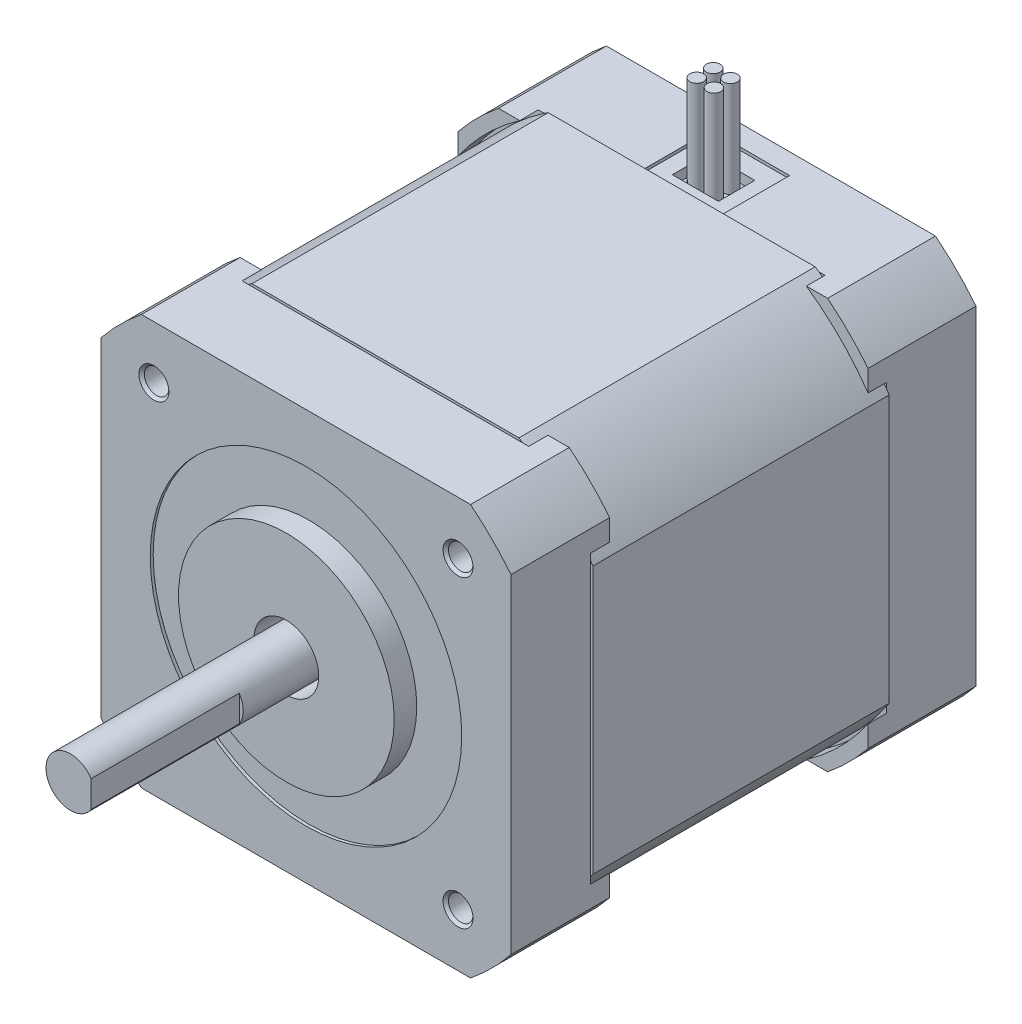
from build123d import *

# Parameters (mm, degrees)
EXTRUDE_1_DEPTH                      = 11
SKETCH_2_R                           = 25.5
CUT_EXTRUDE_1_DEPTH                  = 1.9
EXTRUDE_2_DEPTH                      = 30.2
EXTRUDE_START                        = 39.3
EXTRUDE_3_DEPTH                      = 8.1
EXTRUDE_START_2                      = 1.96
EXTRUDE_4_DEPTH                      = 1.96
SKETCH_5_R                           = 15.875
CUT_EXTRUDE_2_DEPTH                  = 0.3
SKETCH_6_R                           = 10.995
EXTRUDE_5_DEPTH                      = 2.3
SKETCH_7_R                           = 3.3
CUT_EXTRUDE_3_DEPTH                  = 5
SKETCH_8_R                           = 2.5
EXTRUDE_7_DEPTH                      = 27
SKETCH_9_W                           = 0.4
SKETCH_9_H                           = 2.712931994
CUT_EXTRUDE_4_DEPTH                  = 15.1
SKETCH_12_R                          = 3
CUT_EXTRUDE_5_DEPTH                  = 0.3
SKETCH_13_W                          = 1.542437781
SKETCH_13_H                          = 0.838241738
SKETCH_13_W_2                        = 0.838241738
SKETCH_13_H_2                        = 1.542437781
CUT_EXTRUDE_6_DEPTH                  = 2
CHAMFER_1_SIZE                       = 1.54
FILLET_1_R                           = 0.5
PATTERN_CIRCULAR_1_COUNT             = 4
CHAMFER_1_OF_PATTERN_CIRCULAR_1_SIZE = 1.54
FILLET_1_OF_PATTERN_CIRCULAR_1_R     = 0.5
SKETCH_14_W                          = 8
SKETCH_14_H                          = 7
CUT_EXTRUDE_7_DEPTH                  = 0.3
SKETCH_15_W                          = 4.7
SKETCH_15_H                          = 3.7
CUT_EXTRUDE_8_DEPTH                  = 1
SKETCH_16_R                          = 0.7
EXTRUDE_8_DEPTH                      = 9.8


with BuildPart() as part:
    # Эскиз1 → Бобышка-Вытянуть1 (new body)
    with BuildSketch(Plane.XY):
        with BuildLine():
            ThreePointArc((20.9, 16.775875536), (18.950461736, 18.950461736), (16.775875536, 20.9))
            Line((16.775875536, 20.9), (-16.775875536, 20.9))
            ThreePointArc((-16.775875536, 20.9), (-18.950461736, 18.950461736), (-20.9, 16.775875536))
            Line((-20.9, 16.775875536), (-20.9, -16.775875536))
            ThreePointArc((-20.9, -16.775875536), (-18.950461736, -18.950461736), (-16.775875536, -20.9))
            Line((-16.775875536, -20.9), (16.775875536, -20.9))
            ThreePointArc((16.775875536, -20.9), (18.950461736, -18.950461736), (20.9, -16.775875536))
            Line((20.9, -16.775875536), (20.9, 16.775875536))
        make_face()
    extrude(amount=EXTRUDE_1_DEPTH)

    # Эскиз2 → Вырез-Вытянуть1 (cut)
    with BuildSketch(Plane.XY.offset(11)):
        Circle(SKETCH_2_R)
    extrude(amount=-CUT_EXTRUDE_1_DEPTH, mode=Mode.SUBTRACT)

    # Эскиз3 → Бобышка-Вытянуть2 (add)
    with BuildSketch(Plane.XY.offset(9.1)):
        with BuildLine():
            ThreePointArc((20.9, 13.989728375), (17.783735547, 17.783735547), (13.989728375, 20.9))
            Line((13.989728375, 20.9), (-13.989728375, 20.9))
            ThreePointArc((-13.989728375, 20.9), (-17.783735547, 17.783735547), (-20.9, 13.989728375))
            Line((-20.9, 13.989728375), (-20.9, -13.989728375))
            ThreePointArc((-20.9, -13.989728375), (-17.783735547, -17.783735547), (-13.989728375, -20.9))
            Line((-13.989728375, -20.9), (13.989728375, -20.9))
            ThreePointArc((13.989728375, -20.9), (17.783735547, -17.783735547), (20.9, -13.989728375))
            Line((20.9, -13.989728375), (20.9, 13.989728375))
        make_face()
        with BuildLine():
            ThreePointArc((13.989728375, 20.9), (13.799840663, 21.02586259), (13.608820669, 21.15))
            Line((13.608820669, 21.15), (-13.608820669, 21.15))
            ThreePointArc((-13.608820669, 21.15), (-13.799840663, 21.02586259), (-13.989728375, 20.9))
            Line((-13.989728375, 20.9), (13.989728375, 20.9))
        make_face()
        with BuildLine():
            Line((21.15, -13.608820669), (21.15, 13.608820669))
            ThreePointArc((21.15, 13.608820669), (21.02586259, 13.799840663), (20.9, 13.989728375))
            Line((20.9, 13.989728375), (20.9, -13.989728375))
            ThreePointArc((20.9, -13.989728375), (21.02586259, -13.799840663), (21.15, -13.608820669))
        make_face()
        with BuildLine():
            Line((-13.608820669, -21.15), (13.608820669, -21.15))
            ThreePointArc((13.608820669, -21.15), (13.799840663, -21.02586259), (13.989728375, -20.9))
            Line((13.989728375, -20.9), (-13.989728375, -20.9))
            ThreePointArc((-13.989728375, -20.9), (-13.799840663, -21.02586259), (-13.608820669, -21.15))
        make_face()
        with BuildLine():
            ThreePointArc((-20.9, 13.989728375), (-21.02586259, 13.799840663), (-21.15, 13.608820669))
            Line((-21.15, 13.608820669), (-21.15, -13.608820669))
            ThreePointArc((-21.15, -13.608820669), (-21.02586259, -13.799840663), (-20.9, -13.989728375))
            Line((-20.9, -13.989728375), (-20.9, 13.989728375))
        make_face()
    extrude(amount=EXTRUDE_2_DEPTH)

    # Эскиз1<3> → Бобышка-Вытянуть3 (add)
    with BuildSketch(Plane.XY.offset(EXTRUDE_START)):
        with BuildLine():
            ThreePointArc((20.9, 16.775875536), (18.950461736, 18.950461736), (16.775875536, 20.9))
            Line((16.775875536, 20.9), (-16.775875536, 20.9))
            ThreePointArc((-16.775875536, 20.9), (-18.950461736, 18.950461736), (-20.9, 16.775875536))
            Line((-20.9, 16.775875536), (-20.9, -16.775875536))
            ThreePointArc((-20.9, -16.775875536), (-18.950461736, -18.950461736), (-16.775875536, -20.9))
            Line((-16.775875536, -20.9), (16.775875536, -20.9))
            ThreePointArc((16.775875536, -20.9), (18.950461736, -18.950461736), (20.9, -16.775875536))
            Line((20.9, -16.775875536), (20.9, 16.775875536))
        make_face()
    extrude(amount=EXTRUDE_3_DEPTH)

    # Эскиз4 → Бобышка-Вытянуть4 (add)
    with BuildSketch(Plane(origin=(0, 0, 39.3), x_dir=(-1, 0, 0), z_dir=(0, 0, -1)).offset(EXTRUDE_START_2)):
        with BuildLine():
            Line((14.609585894, 20.9), (16.775875536, 20.9))
            ThreePointArc((16.775875536, 20.9), (18.950461736, 18.950461736), (20.9, 16.775875536))
            Line((20.9, 16.775875536), (20.9, 14.609585894))
            ThreePointArc((20.9, 14.609585894), (18.03122292, 18.03122292), (14.609585894, 20.9))
        make_face()
        with BuildLine():
            Line((20.9, -14.609585894), (20.9, -16.775875536))
            ThreePointArc((20.9, -16.775875536), (18.950461736, -18.950461736), (16.775875536, -20.9))
            Line((16.775875536, -20.9), (14.609585894, -20.9))
            ThreePointArc((14.609585894, -20.9), (18.03122292, -18.03122292), (20.9, -14.609585894))
        make_face()
        with BuildLine():
            Line((-14.609585894, -20.9), (-16.775875536, -20.9))
            ThreePointArc((-16.775875536, -20.9), (-18.950461736, -18.950461736), (-20.9, -16.775875536))
            Line((-20.9, -16.775875536), (-20.9, -14.609585894))
            ThreePointArc((-20.9, -14.609585894), (-18.03122292, -18.03122292), (-14.609585894, -20.9))
        make_face()
        with BuildLine():
            Line((-20.9, 14.609585894), (-20.9, 16.775875536))
            ThreePointArc((-20.9, 16.775875536), (-18.950461736, 18.950461736), (-16.775875536, 20.9))
            Line((-16.775875536, 20.9), (-14.609585894, 20.9))
            ThreePointArc((-14.609585894, 20.9), (-18.03122292, 18.03122292), (-20.9, 14.609585894))
        make_face()
    extrude(amount=-EXTRUDE_4_DEPTH)

    # Эскиз5 → Вырез-Вытянуть2 (cut)
    with BuildSketch(Plane.XY.offset(47.4)):
        Circle(SKETCH_5_R)
    extrude(amount=-CUT_EXTRUDE_2_DEPTH, mode=Mode.SUBTRACT)

    # Эскиз6 → Бобышка-Вытянуть5 (add)
    with BuildSketch(Plane.XY.offset(47.1)):
        Circle(SKETCH_6_R)
    extrude(amount=EXTRUDE_5_DEPTH)

    # Эскиз7 → Вырез-Вытянуть3 (cut)
    with BuildSketch(Plane.XY.offset(49.4)):
        Circle(SKETCH_7_R)
    extrude(amount=-CUT_EXTRUDE_3_DEPTH, mode=Mode.SUBTRACT)

    # Эскиз8 → Бобышка-Вытянуть7 (add)
    with BuildSketch(Plane.XY.offset(44.4)):
        with Locations(Location((0, 0, 0), (0, 0, 180))):
            Circle(SKETCH_8_R)
    extrude(amount=EXTRUDE_7_DEPTH)

    # Эскиз9 → Вырез-Вытянуть4 (cut)
    with BuildSketch(Plane.XY.offset(71.4)):
        with Locations((2.3, 0)):
            Rectangle(SKETCH_9_W, SKETCH_9_H)
    extrude(amount=-CUT_EXTRUDE_4_DEPTH, mode=Mode.SUBTRACT)

    # Эскиз11 → Отверстие обработанное метчиком M31 (revolve, cut)
    with BuildSketch(Plane(origin=(-15.5, 15.5, 47.4), x_dir=(0, -1, 0), z_dir=(1, 0, 0))):
        Polygon((0, 0), (0, 6.751075774), (1.25, 6), (1.25, 0.275), (1.525, 0), align=None)
    hole_wizard_m31 = revolve(axis=Axis((-15.5, 15.5, 53.75), (0, 0, -1)), mode=Mode.SUBTRACT)

    # Эскиз12 → Вырез-Вытянуть5 (cut)
    with BuildSketch(Plane(origin=(0, 0, 0), x_dir=(-1, 0, 0), z_dir=(0, 0, -1))):
        with Locations((15.5, 15.5)):
            Circle(SKETCH_12_R)
    cut_extrude_5 = extrude(amount=-CUT_EXTRUDE_5_DEPTH, mode=Mode.SUBTRACT)

    # Эскиз13 → Вырез-Вытянуть6 (cut)
    with BuildSketch(Plane(origin=(0, 0, 0.3), x_dir=(-1, 0, 0), z_dir=(0, 0, -1))):
        with Locations((14.309660241, 15.5)):
            Rectangle(SKETCH_13_W, SKETCH_13_H)
        with Locations((15.5, 16.690339759)):
            Rectangle(SKETCH_13_W_2, SKETCH_13_H_2)
        with Locations((15.5, 15.5)):
            Rectangle(SKETCH_13_W_2, SKETCH_13_H)
        with Locations((16.690339759, 15.5)):
            Rectangle(SKETCH_13_W, SKETCH_13_H)
        with Locations((15.5, 14.309660241)):
            Rectangle(SKETCH_13_W_2, SKETCH_13_H_2)
    cut_extrude_6 = extrude(amount=-CUT_EXTRUDE_6_DEPTH, mode=Mode.SUBTRACT)

    # Фаска1
    chamfer_1_edges = [part.edges().sort_by_distance(p)[0] for p in [
        (-13.53844135, 15.5, 2.3),
        (-15.5, 13.53844135, 2.3),
        (-15.5, 17.46155865, 2.3),
        (-17.46155865, 15.5, 2.3),
    ]]
    chamfer(chamfer_1_edges, length=CHAMFER_1_SIZE)

    # Скругление1
    # the kernel refuses this fillet: 0.5 mm, written as the material it takes off along each edge
    with BuildSketch(Plane(origin=(-15.080879131, 15.080879131, -0.95), x_dir=(0, -1, 0), z_dir=(0, 0, 1))) as fillet_1_piece_1_section:
        with BuildLine():
            CenterArc((FILLET_1_R, FILLET_1_R), FILLET_1_R, 180, 90)
            Line((0, FILLET_1_R), (0, 0))
            Line((0, 0), (FILLET_1_R, 0))
        make_face()
    fillet_1_piece_1 = extrude(amount=3.25, mode=Mode.PRIVATE)
    fillet_1_piece_1 = split(fillet_1_piece_1, bisect_by=Plane(origin=(-14.969196905, 14.165454231, 1.38701288), z_dir=(0, 0.7071067811865478, -0.7071067811865474)), keep=Keep.TOP, mode=Mode.PRIVATE)
    fillet_1_piece_1 = split(fillet_1_piece_1, bisect_by=Plane(origin=(-14.165454231, 14.969196905, 1.38701288), z_dir=(-0.7071067811865478, 1.491325558184438e-15, -0.7071067811865474)), keep=Keep.TOP, mode=Mode.PRIVATE)
    add(fillet_1_piece_1, mode=Mode.SUBTRACT)
    with BuildSketch(Plane(origin=(-15.919120869, 15.080879131, -0.95), x_dir=(0, -1, 0), z_dir=(0, 0, 1))) as fillet_1_piece_2_section:
        with BuildLine():
            CenterArc((FILLET_1_R, -FILLET_1_R), FILLET_1_R, 90, 90)
            Line((0, -FILLET_1_R), (0, 0))
            Line((0, 0), (FILLET_1_R, 0))
        make_face()
    fillet_1_piece_2 = extrude(amount=3.25, mode=Mode.PRIVATE)
    fillet_1_piece_2 = split(fillet_1_piece_2, bisect_by=Plane(origin=(-16.030803095, 14.165454231, 1.38701288), z_dir=(0, 0.7071067811865478, -0.7071067811865474)), keep=Keep.TOP, mode=Mode.PRIVATE)
    fillet_1_piece_2 = split(fillet_1_piece_2, bisect_by=Plane(origin=(-16.834545769, 14.969196905, 1.38701288), z_dir=(0.7071067811865478, 0, -0.7071067811865474)), keep=Keep.TOP, mode=Mode.PRIVATE)
    add(fillet_1_piece_2, mode=Mode.SUBTRACT)
    with BuildSketch(Plane(origin=(-15.080879131, 15.919120869, -0.95), x_dir=(0, 1, 0), z_dir=(0, 0, 1))) as fillet_1_piece_3_section:
        with BuildLine():
            CenterArc((FILLET_1_R, -FILLET_1_R), FILLET_1_R, 90, 90)
            Line((0, -FILLET_1_R), (0, 0))
            Line((0, 0), (FILLET_1_R, 0))
        make_face()
    fillet_1_piece_3 = extrude(amount=3.25, mode=Mode.PRIVATE)
    fillet_1_piece_3 = split(fillet_1_piece_3, bisect_by=Plane(origin=(-14.969196905, 16.834545769, 1.38701288), z_dir=(0, -0.7071067811865478, -0.7071067811865474)), keep=Keep.TOP, mode=Mode.PRIVATE)
    fillet_1_piece_3 = split(fillet_1_piece_3, bisect_by=Plane(origin=(-14.165454231, 16.030803095, 1.38701288), z_dir=(-0.7071067811865478, 1.491325558184438e-15, -0.7071067811865474)), keep=Keep.TOP, mode=Mode.PRIVATE)
    add(fillet_1_piece_3, mode=Mode.SUBTRACT)
    with BuildSketch(Plane(origin=(-15.919120869, 15.919120869, -0.95), x_dir=(-1, 0, 0), z_dir=(0, 0, 1))) as fillet_1_piece_4_section:
        with BuildLine():
            CenterArc((FILLET_1_R, -FILLET_1_R), FILLET_1_R, 90, 90)
            Line((0, -FILLET_1_R), (0, 0))
            Line((0, 0), (FILLET_1_R, 0))
        make_face()
    fillet_1_piece_4 = extrude(amount=3.25, mode=Mode.PRIVATE)
    fillet_1_piece_4 = split(fillet_1_piece_4, bisect_by=Plane(origin=(-16.834545769, 16.030803095, 1.38701288), z_dir=(0.7071067811865478, 0, -0.7071067811865474)), keep=Keep.TOP, mode=Mode.PRIVATE)
    fillet_1_piece_4 = split(fillet_1_piece_4, bisect_by=Plane(origin=(-16.030803095, 16.834545769, 1.38701288), z_dir=(0, -0.7071067811865478, -0.7071067811865474)), keep=Keep.TOP, mode=Mode.PRIVATE)
    add(fillet_1_piece_4, mode=Mode.SUBTRACT)

    # Круговой массив1: Отверстие обработанное метчиком M31, Вырез-Вытянуть5, Вырез-Вытянуть6 ×4 about axis
    pattern_circular_1_axis = Axis((0, 0, 0), (0, 0, 1))
    add([hole_wizard_m31.rotate(pattern_circular_1_axis, i * 360 / PATTERN_CIRCULAR_1_COUNT) for i in range(1, PATTERN_CIRCULAR_1_COUNT)], mode=Mode.SUBTRACT)
    add([cut_extrude_5.rotate(pattern_circular_1_axis, i * 360 / PATTERN_CIRCULAR_1_COUNT) for i in range(1, PATTERN_CIRCULAR_1_COUNT)], mode=Mode.SUBTRACT)
    add([cut_extrude_6.rotate(pattern_circular_1_axis, i * 360 / PATTERN_CIRCULAR_1_COUNT) for i in range(1, PATTERN_CIRCULAR_1_COUNT)], mode=Mode.SUBTRACT)

    # Фаска1 of Круговой массив1
    chamfer_1_of_pattern_circular_1_edges = [part.edges().sort_by_distance(p)[0] for p in [
        (-15.5, -13.53844135, 2.3),
        (-13.53844135, -15.5, 2.3),
        (-17.46155865, -15.5, 2.3),
        (-15.5, -17.46155865, 2.3),
        (13.53844135, -15.5, 2.3),
        (15.5, -13.53844135, 2.3),
        (15.5, -17.46155865, 2.3),
        (17.46155865, -15.5, 2.3),
        (15.5, 13.53844135, 2.3),
        (13.53844135, 15.5, 2.3),
        (17.46155865, 15.5, 2.3),
        (15.5, 17.46155865, 2.3),
    ]]
    chamfer(chamfer_1_of_pattern_circular_1_edges, length=CHAMFER_1_OF_PATTERN_CIRCULAR_1_SIZE)

    # Скругление1 of Круговой массив1
    # the kernel refuses this fillet: 0.5 mm, written as the material it takes off along each edge
    with BuildSketch(Plane(origin=(-15.080879131, -15.080879131, -0.95), x_dir=(1, 0, 0), z_dir=(0, 0, 1))) as fillet_1_of_pattern_circular_1_piece_1_section:
        with BuildLine():
            CenterArc((FILLET_1_OF_PATTERN_CIRCULAR_1_R, FILLET_1_OF_PATTERN_CIRCULAR_1_R), FILLET_1_OF_PATTERN_CIRCULAR_1_R, 180, 90)
            Line((0, FILLET_1_OF_PATTERN_CIRCULAR_1_R), (0, 0))
            Line((0, 0), (FILLET_1_OF_PATTERN_CIRCULAR_1_R, 0))
        make_face()
    fillet_1_of_pattern_circular_1_piece_1 = extrude(amount=3.25, mode=Mode.PRIVATE)
    fillet_1_of_pattern_circular_1_piece_1 = split(fillet_1_of_pattern_circular_1_piece_1, bisect_by=Plane(origin=(-14.165454231, -14.969196905, 1.38701288), z_dir=(-0.7071067811865478, 0, -0.7071067811865474)), keep=Keep.TOP, mode=Mode.PRIVATE)
    fillet_1_of_pattern_circular_1_piece_1 = split(fillet_1_of_pattern_circular_1_piece_1, bisect_by=Plane(origin=(-14.969196905, -14.165454231, 1.38701288), z_dir=(-1.4913255581844381e-15, -0.7071067811865478, -0.7071067811865474)), keep=Keep.TOP, mode=Mode.PRIVATE)
    add(fillet_1_of_pattern_circular_1_piece_1, mode=Mode.SUBTRACT)
    with BuildSketch(Plane(origin=(-15.080879131, -15.919120869, -0.95), x_dir=(1, 0, 0), z_dir=(0, 0, 1))) as fillet_1_of_pattern_circular_1_piece_2_section:
        with BuildLine():
            CenterArc((FILLET_1_OF_PATTERN_CIRCULAR_1_R, -FILLET_1_OF_PATTERN_CIRCULAR_1_R), FILLET_1_OF_PATTERN_CIRCULAR_1_R, 90, 90)
            Line((0, -FILLET_1_OF_PATTERN_CIRCULAR_1_R), (0, 0))
            Line((0, 0), (FILLET_1_OF_PATTERN_CIRCULAR_1_R, 0))
        make_face()
    fillet_1_of_pattern_circular_1_piece_2 = extrude(amount=3.25, mode=Mode.PRIVATE)
    fillet_1_of_pattern_circular_1_piece_2 = split(fillet_1_of_pattern_circular_1_piece_2, bisect_by=Plane(origin=(-14.165454231, -16.030803095, 1.38701288), z_dir=(-0.7071067811865478, 0, -0.7071067811865474)), keep=Keep.TOP, mode=Mode.PRIVATE)
    fillet_1_of_pattern_circular_1_piece_2 = split(fillet_1_of_pattern_circular_1_piece_2, bisect_by=Plane(origin=(-14.969196905, -16.834545769, 1.38701288), z_dir=(0, 0.7071067811865478, -0.7071067811865474)), keep=Keep.TOP, mode=Mode.PRIVATE)
    add(fillet_1_of_pattern_circular_1_piece_2, mode=Mode.SUBTRACT)
    with BuildSketch(Plane(origin=(-15.919120869, -15.080879131, -0.95), x_dir=(-1, 0, 0), z_dir=(0, 0, 1))) as fillet_1_of_pattern_circular_1_piece_3_section:
        with BuildLine():
            CenterArc((FILLET_1_OF_PATTERN_CIRCULAR_1_R, -FILLET_1_OF_PATTERN_CIRCULAR_1_R), FILLET_1_OF_PATTERN_CIRCULAR_1_R, 90, 90)
            Line((0, -FILLET_1_OF_PATTERN_CIRCULAR_1_R), (0, 0))
            Line((0, 0), (FILLET_1_OF_PATTERN_CIRCULAR_1_R, 0))
        make_face()
    fillet_1_of_pattern_circular_1_piece_3 = extrude(amount=3.25, mode=Mode.PRIVATE)
    fillet_1_of_pattern_circular_1_piece_3 = split(fillet_1_of_pattern_circular_1_piece_3, bisect_by=Plane(origin=(-16.834545769, -14.969196905, 1.38701288), z_dir=(0.7071067811865478, 0, -0.7071067811865474)), keep=Keep.TOP, mode=Mode.PRIVATE)
    fillet_1_of_pattern_circular_1_piece_3 = split(fillet_1_of_pattern_circular_1_piece_3, bisect_by=Plane(origin=(-16.030803095, -14.165454231, 1.38701288), z_dir=(-1.4913255581844381e-15, -0.7071067811865478, -0.7071067811865474)), keep=Keep.TOP, mode=Mode.PRIVATE)
    add(fillet_1_of_pattern_circular_1_piece_3, mode=Mode.SUBTRACT)
    with BuildSketch(Plane(origin=(-15.919120869, -15.919120869, -0.95), x_dir=(0, -1, 0), z_dir=(0, 0, 1))) as fillet_1_of_pattern_circular_1_piece_4_section:
        with BuildLine():
            CenterArc((FILLET_1_OF_PATTERN_CIRCULAR_1_R, -FILLET_1_OF_PATTERN_CIRCULAR_1_R), FILLET_1_OF_PATTERN_CIRCULAR_1_R, 90, 90)
            Line((0, -FILLET_1_OF_PATTERN_CIRCULAR_1_R), (0, 0))
            Line((0, 0), (FILLET_1_OF_PATTERN_CIRCULAR_1_R, 0))
        make_face()
    fillet_1_of_pattern_circular_1_piece_4 = extrude(amount=3.25, mode=Mode.PRIVATE)
    fillet_1_of_pattern_circular_1_piece_4 = split(fillet_1_of_pattern_circular_1_piece_4, bisect_by=Plane(origin=(-16.030803095, -16.834545769, 1.38701288), z_dir=(0, 0.7071067811865478, -0.7071067811865474)), keep=Keep.TOP, mode=Mode.PRIVATE)
    fillet_1_of_pattern_circular_1_piece_4 = split(fillet_1_of_pattern_circular_1_piece_4, bisect_by=Plane(origin=(-16.834545769, -16.030803095, 1.38701288), z_dir=(0.7071067811865478, 0, -0.7071067811865474)), keep=Keep.TOP, mode=Mode.PRIVATE)
    add(fillet_1_of_pattern_circular_1_piece_4, mode=Mode.SUBTRACT)
    with BuildSketch(Plane(origin=(15.080879131, -15.080879131, -0.95), x_dir=(0, 1, 0), z_dir=(0, 0, 1))) as fillet_1_of_pattern_circular_1_piece_5_section:
        with BuildLine():
            CenterArc((FILLET_1_OF_PATTERN_CIRCULAR_1_R, FILLET_1_OF_PATTERN_CIRCULAR_1_R), FILLET_1_OF_PATTERN_CIRCULAR_1_R, 180, 90)
            Line((0, FILLET_1_OF_PATTERN_CIRCULAR_1_R), (0, 0))
            Line((0, 0), (FILLET_1_OF_PATTERN_CIRCULAR_1_R, 0))
        make_face()
    fillet_1_of_pattern_circular_1_piece_5 = extrude(amount=3.25, mode=Mode.PRIVATE)
    fillet_1_of_pattern_circular_1_piece_5 = split(fillet_1_of_pattern_circular_1_piece_5, bisect_by=Plane(origin=(14.969196905, -14.165454231, 1.38701288), z_dir=(0, -0.7071067811865478, -0.7071067811865474)), keep=Keep.TOP, mode=Mode.PRIVATE)
    fillet_1_of_pattern_circular_1_piece_5 = split(fillet_1_of_pattern_circular_1_piece_5, bisect_by=Plane(origin=(14.165454231, -14.969196905, 1.38701288), z_dir=(0.7071067811865478, -1.4913255581844381e-15, -0.7071067811865474)), keep=Keep.TOP, mode=Mode.PRIVATE)
    add(fillet_1_of_pattern_circular_1_piece_5, mode=Mode.SUBTRACT)
    with BuildSketch(Plane(origin=(15.919120869, -15.080879131, -0.95), x_dir=(0, 1, 0), z_dir=(0, 0, 1))) as fillet_1_of_pattern_circular_1_piece_6_section:
        with BuildLine():
            CenterArc((FILLET_1_OF_PATTERN_CIRCULAR_1_R, -FILLET_1_OF_PATTERN_CIRCULAR_1_R), FILLET_1_OF_PATTERN_CIRCULAR_1_R, 90, 90)
            Line((0, -FILLET_1_OF_PATTERN_CIRCULAR_1_R), (0, 0))
            Line((0, 0), (FILLET_1_OF_PATTERN_CIRCULAR_1_R, 0))
        make_face()
    fillet_1_of_pattern_circular_1_piece_6 = extrude(amount=3.25, mode=Mode.PRIVATE)
    fillet_1_of_pattern_circular_1_piece_6 = split(fillet_1_of_pattern_circular_1_piece_6, bisect_by=Plane(origin=(16.030803095, -14.165454231, 1.38701288), z_dir=(0, -0.7071067811865478, -0.7071067811865474)), keep=Keep.TOP, mode=Mode.PRIVATE)
    fillet_1_of_pattern_circular_1_piece_6 = split(fillet_1_of_pattern_circular_1_piece_6, bisect_by=Plane(origin=(16.834545769, -14.969196905, 1.38701288), z_dir=(-0.7071067811865478, 0, -0.7071067811865474)), keep=Keep.TOP, mode=Mode.PRIVATE)
    add(fillet_1_of_pattern_circular_1_piece_6, mode=Mode.SUBTRACT)
    with BuildSketch(Plane(origin=(15.080879131, -15.919120869, -0.95), x_dir=(0, -1, 0), z_dir=(0, 0, 1))) as fillet_1_of_pattern_circular_1_piece_7_section:
        with BuildLine():
            CenterArc((FILLET_1_OF_PATTERN_CIRCULAR_1_R, -FILLET_1_OF_PATTERN_CIRCULAR_1_R), FILLET_1_OF_PATTERN_CIRCULAR_1_R, 90, 90)
            Line((0, -FILLET_1_OF_PATTERN_CIRCULAR_1_R), (0, 0))
            Line((0, 0), (FILLET_1_OF_PATTERN_CIRCULAR_1_R, 0))
        make_face()
    fillet_1_of_pattern_circular_1_piece_7 = extrude(amount=3.25, mode=Mode.PRIVATE)
    fillet_1_of_pattern_circular_1_piece_7 = split(fillet_1_of_pattern_circular_1_piece_7, bisect_by=Plane(origin=(14.969196905, -16.834545769, 1.38701288), z_dir=(0, 0.7071067811865478, -0.7071067811865474)), keep=Keep.TOP, mode=Mode.PRIVATE)
    fillet_1_of_pattern_circular_1_piece_7 = split(fillet_1_of_pattern_circular_1_piece_7, bisect_by=Plane(origin=(14.165454231, -16.030803095, 1.38701288), z_dir=(0.7071067811865478, -1.4913255581844381e-15, -0.7071067811865474)), keep=Keep.TOP, mode=Mode.PRIVATE)
    add(fillet_1_of_pattern_circular_1_piece_7, mode=Mode.SUBTRACT)
    with BuildSketch(Plane(origin=(15.919120869, -15.919120869, -0.95), x_dir=(1, 0, 0), z_dir=(0, 0, 1))) as fillet_1_of_pattern_circular_1_piece_8_section:
        with BuildLine():
            CenterArc((FILLET_1_OF_PATTERN_CIRCULAR_1_R, -FILLET_1_OF_PATTERN_CIRCULAR_1_R), FILLET_1_OF_PATTERN_CIRCULAR_1_R, 90, 90)
            Line((0, -FILLET_1_OF_PATTERN_CIRCULAR_1_R), (0, 0))
            Line((0, 0), (FILLET_1_OF_PATTERN_CIRCULAR_1_R, 0))
        make_face()
    fillet_1_of_pattern_circular_1_piece_8 = extrude(amount=3.25, mode=Mode.PRIVATE)
    fillet_1_of_pattern_circular_1_piece_8 = split(fillet_1_of_pattern_circular_1_piece_8, bisect_by=Plane(origin=(16.834545769, -16.030803095, 1.38701288), z_dir=(-0.7071067811865478, 0, -0.7071067811865474)), keep=Keep.TOP, mode=Mode.PRIVATE)
    fillet_1_of_pattern_circular_1_piece_8 = split(fillet_1_of_pattern_circular_1_piece_8, bisect_by=Plane(origin=(16.030803095, -16.834545769, 1.38701288), z_dir=(0, 0.7071067811865478, -0.7071067811865474)), keep=Keep.TOP, mode=Mode.PRIVATE)
    add(fillet_1_of_pattern_circular_1_piece_8, mode=Mode.SUBTRACT)
    with BuildSketch(Plane(origin=(15.080879131, 15.080879131, -0.95), x_dir=(-1, 0, 0), z_dir=(0, 0, 1))) as fillet_1_of_pattern_circular_1_piece_9_section:
        with BuildLine():
            CenterArc((FILLET_1_OF_PATTERN_CIRCULAR_1_R, FILLET_1_OF_PATTERN_CIRCULAR_1_R), FILLET_1_OF_PATTERN_CIRCULAR_1_R, 180, 90)
            Line((0, FILLET_1_OF_PATTERN_CIRCULAR_1_R), (0, 0))
            Line((0, 0), (FILLET_1_OF_PATTERN_CIRCULAR_1_R, 0))
        make_face()
    fillet_1_of_pattern_circular_1_piece_9 = extrude(amount=3.25, mode=Mode.PRIVATE)
    fillet_1_of_pattern_circular_1_piece_9 = split(fillet_1_of_pattern_circular_1_piece_9, bisect_by=Plane(origin=(14.165454231, 14.969196905, 1.38701288), z_dir=(0.7071067811865478, 0, -0.7071067811865474)), keep=Keep.TOP, mode=Mode.PRIVATE)
    fillet_1_of_pattern_circular_1_piece_9 = split(fillet_1_of_pattern_circular_1_piece_9, bisect_by=Plane(origin=(14.969196905, 14.165454231, 1.38701288), z_dir=(1.4913255581844381e-15, 0.7071067811865478, -0.7071067811865474)), keep=Keep.TOP, mode=Mode.PRIVATE)
    add(fillet_1_of_pattern_circular_1_piece_9, mode=Mode.SUBTRACT)
    with BuildSketch(Plane(origin=(15.080879131, 15.919120869, -0.95), x_dir=(-1, 0, 0), z_dir=(0, 0, 1))) as fillet_1_of_pattern_circular_1_piece_10_section:
        with BuildLine():
            CenterArc((FILLET_1_OF_PATTERN_CIRCULAR_1_R, -FILLET_1_OF_PATTERN_CIRCULAR_1_R), FILLET_1_OF_PATTERN_CIRCULAR_1_R, 90, 90)
            Line((0, -FILLET_1_OF_PATTERN_CIRCULAR_1_R), (0, 0))
            Line((0, 0), (FILLET_1_OF_PATTERN_CIRCULAR_1_R, 0))
        make_face()
    fillet_1_of_pattern_circular_1_piece_10 = extrude(amount=3.25, mode=Mode.PRIVATE)
    fillet_1_of_pattern_circular_1_piece_10 = split(fillet_1_of_pattern_circular_1_piece_10, bisect_by=Plane(origin=(14.165454231, 16.030803095, 1.38701288), z_dir=(0.7071067811865478, 0, -0.7071067811865474)), keep=Keep.TOP, mode=Mode.PRIVATE)
    fillet_1_of_pattern_circular_1_piece_10 = split(fillet_1_of_pattern_circular_1_piece_10, bisect_by=Plane(origin=(14.969196905, 16.834545769, 1.38701288), z_dir=(0, -0.7071067811865478, -0.7071067811865474)), keep=Keep.TOP, mode=Mode.PRIVATE)
    add(fillet_1_of_pattern_circular_1_piece_10, mode=Mode.SUBTRACT)
    with BuildSketch(Plane(origin=(15.919120869, 15.080879131, -0.95), x_dir=(1, 0, 0), z_dir=(0, 0, 1))) as fillet_1_of_pattern_circular_1_piece_11_section:
        with BuildLine():
            CenterArc((FILLET_1_OF_PATTERN_CIRCULAR_1_R, -FILLET_1_OF_PATTERN_CIRCULAR_1_R), FILLET_1_OF_PATTERN_CIRCULAR_1_R, 90, 90)
            Line((0, -FILLET_1_OF_PATTERN_CIRCULAR_1_R), (0, 0))
            Line((0, 0), (FILLET_1_OF_PATTERN_CIRCULAR_1_R, 0))
        make_face()
    fillet_1_of_pattern_circular_1_piece_11 = extrude(amount=3.25, mode=Mode.PRIVATE)
    fillet_1_of_pattern_circular_1_piece_11 = split(fillet_1_of_pattern_circular_1_piece_11, bisect_by=Plane(origin=(16.834545769, 14.969196905, 1.38701288), z_dir=(-0.7071067811865478, 0, -0.7071067811865474)), keep=Keep.TOP, mode=Mode.PRIVATE)
    fillet_1_of_pattern_circular_1_piece_11 = split(fillet_1_of_pattern_circular_1_piece_11, bisect_by=Plane(origin=(16.030803095, 14.165454231, 1.38701288), z_dir=(1.4913255581844381e-15, 0.7071067811865478, -0.7071067811865474)), keep=Keep.TOP, mode=Mode.PRIVATE)
    add(fillet_1_of_pattern_circular_1_piece_11, mode=Mode.SUBTRACT)
    with BuildSketch(Plane(origin=(15.919120869, 15.919120869, -0.95), x_dir=(0, 1, 0), z_dir=(0, 0, 1))) as fillet_1_of_pattern_circular_1_piece_12_section:
        with BuildLine():
            CenterArc((FILLET_1_OF_PATTERN_CIRCULAR_1_R, -FILLET_1_OF_PATTERN_CIRCULAR_1_R), FILLET_1_OF_PATTERN_CIRCULAR_1_R, 90, 90)
            Line((0, -FILLET_1_OF_PATTERN_CIRCULAR_1_R), (0, 0))
            Line((0, 0), (FILLET_1_OF_PATTERN_CIRCULAR_1_R, 0))
        make_face()
    fillet_1_of_pattern_circular_1_piece_12 = extrude(amount=3.25, mode=Mode.PRIVATE)
    fillet_1_of_pattern_circular_1_piece_12 = split(fillet_1_of_pattern_circular_1_piece_12, bisect_by=Plane(origin=(16.030803095, 16.834545769, 1.38701288), z_dir=(0, -0.7071067811865478, -0.7071067811865474)), keep=Keep.TOP, mode=Mode.PRIVATE)
    fillet_1_of_pattern_circular_1_piece_12 = split(fillet_1_of_pattern_circular_1_piece_12, bisect_by=Plane(origin=(16.834545769, 16.030803095, 1.38701288), z_dir=(-0.7071067811865478, 0, -0.7071067811865474)), keep=Keep.TOP, mode=Mode.PRIVATE)
    add(fillet_1_of_pattern_circular_1_piece_12, mode=Mode.SUBTRACT)

    # Эскиз14 → Вырез-Вытянуть7 (cut)
    with BuildSketch(Plane(origin=(0, 20.9, 0), x_dir=(1, 0, 0), z_dir=(0, 1, 0))):
        with Locations((0, -5.6)):
            Rectangle(SKETCH_14_W, SKETCH_14_H)
    extrude(amount=-CUT_EXTRUDE_7_DEPTH, mode=Mode.SUBTRACT)

    # Эскиз15 → Вырез-Вытянуть8 (cut)
    with BuildSketch(Plane(origin=(0, 20.6, 0), x_dir=(1, 0, 0), z_dir=(0, 1, 0))):
        with Locations((0, -5.85)):
            Rectangle(SKETCH_15_W, SKETCH_15_H)
    extrude(amount=-CUT_EXTRUDE_8_DEPTH, mode=Mode.SUBTRACT)

    # Эскиз16 → Бобышка-Вытянуть8 (add)
    with BuildSketch(Plane(origin=(0, 19.6, 0), x_dir=(1, 0, 0), z_dir=(0, 1, 0))):
        with Locations(Location((-0.87627139, -6.692070373, 0), (0, 0, 90))):
            Circle(SKETCH_16_R)
        with Locations(Location((0.87627139, -6.692070373, 0), (0, 0, 90))):
            Circle(SKETCH_16_R)
        with Locations(Location((0.87627139, -5.007929627, 0), (0, 0, 90))):
            Circle(SKETCH_16_R)
        with Locations(Location((-0.87627139, -5.007929627, 0), (0, 0, 90))):
            Circle(SKETCH_16_R)
    extrude(amount=EXTRUDE_8_DEPTH)


solid = part.part
